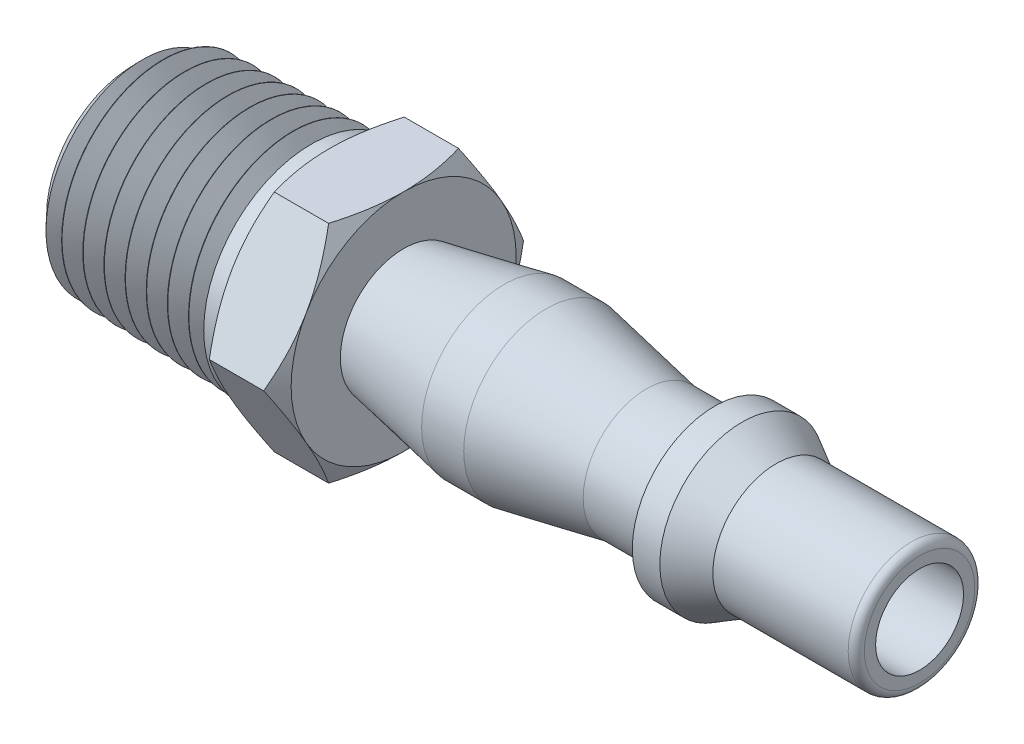
from build123d import *

# Parameters (mm, degrees)
SKETCH2_R          = 10.000000000000004
CUT_EXTRUDE1_DEPTH = 40.11599289293319
CHAMFER1_SIZE      = 1
CHAMFER1_SIZE2     = 1.0234835477782653
FILLET1_R          = 0.5
CUT_SWEEP1_PITCH   = 1.3371862845466156
CUT_SWEEP1_HEIGHT  = 11.363157894736842
CUT_SWEEP1_RADIUS  = 6.372687333572776


with BuildPart() as part:
    # Sketch1 → Revolve1 (revolve)
    with BuildSketch(Plane.XY, mode=Mode.PRIVATE) as revolve1_sk:
        Polygon((9.7e-16, 6.35), (1.41e-15, 2.715), (48.6, 2.715), (48.6, 3.9099999999999993), (39.74, 3.9099999999999984), (37.64000000000001, 5.084999999999999), (35.940000000000005, 5.085), (35.940000000000005, 3.9099999999999984), (31.730000000000008, 3.9099999999999975), (25.530000000000005, 5.089999999999999), (22.930000000000003, 5.089999999999999), (16.729999999999993, 3.909999999999996), (16.73, 10.000000000000002), (12.130000000000003, 10.000000000000002), (12.130000000000003, 6.650000000000001), (11.030000000000001, 6.65), (11.030000000000001, 6.600305715665388), align=None)
    revolve(revolve1_sk.sketch.rotate(Axis((0, 0, 0), (1, 0, 0)), 90), axis=Axis((0, 0, 0), (1, 0, 0)))

    # Sketch2 → Cut-Extrude1 (cut, through all)
    with BuildSketch(Plane.ZY.offset(-12.130000000000003)):
        Circle(SKETCH2_R)
        Polygon((-4.012584370867899, 6.950000000000002), (-8.025168741735799, 1.6e-16), (-4.012584370867893, -6.950000000000008), (4.012584370867905, -6.950000000000006), (8.025168741735804, 2.2e-16), (4.012584370867903, 6.950000000000002), align=None, mode=Mode.SUBTRACT)
    extrude(amount=-CUT_EXTRUDE1_DEPTH, mode=Mode.SUBTRACT)

    # Sketch3 → Cut-Revolve1 (revolve, cut)
    with BuildSketch(Plane(origin=(0, 0, 0), x_dir=(1, 0, 0), z_dir=(0, 1, 0))):
        Polygon((12.130000000000003, 6.95), (12.750748962465428, 8.0251687417358), (12.130000000000003, 8.025168741735799), align=None)
        Polygon((16.729999999999993, 8.0251687417358), (16.729999999999993, 6.950000000000001), (16.10925103753457, 8.025168741735799), align=None)
    revolve(axis=Axis((9.7e-16, 0, 0), (1, 0, 0)), mode=Mode.SUBTRACT)

    # Chamfer1
    chamfer1_edges = [part.edges().sort_by_distance(p)[0] for p in [
        (9.7e-16, -1.48e-15, -6.35),
    ]]
    chamfer1_side = [part.faces().sort_by_distance(p)[0] for p in [
        (5.515000000000002, -1.51e-15, -6.475152857832693),
    ]]
    chamfer(chamfer1_edges, length=CHAMFER1_SIZE, length2=CHAMFER1_SIZE2, reference=chamfer1_side[0])

    # Fillet1
    fillet1_edges = [part.edges().sort_by_distance(p)[0] for p in [
        (48.6, -9.1e-16, -3.9099999999999993),
    ]]
    fillet(fillet1_edges, radius=FILLET1_R)

    # Cut-Sweep1: sweep along a helix
    with BuildLine() as cut_sweep1_path:
        # a taper helix: rise per turn along the axis 1.3368421052631576, along the cone's slant (build123d's pitch) 1.3371862845466156
        Helix(CUT_SWEEP1_PITCH, CUT_SWEEP1_HEIGHT, CUT_SWEEP1_RADIUS, center=(0, 0, 0), direction=(1, 0, 0), cone_angle=1.3)
    # Sketch5 → Cut-Sweep1 (sweep, cut)
    with BuildSketch(Plane(origin=(0, 0, 0), x_dir=(1, 0, 0), z_dir=(0, 1, 0))):
        Polygon((0.668421052631579, -6.372687333572776), (-0.6684210526315786, -6.372687333572776), (0, -5.214948109566213), align=None)
    sweep(path=cut_sweep1_path.line, is_frenet=True, mode=Mode.SUBTRACT)


solid = part.part
